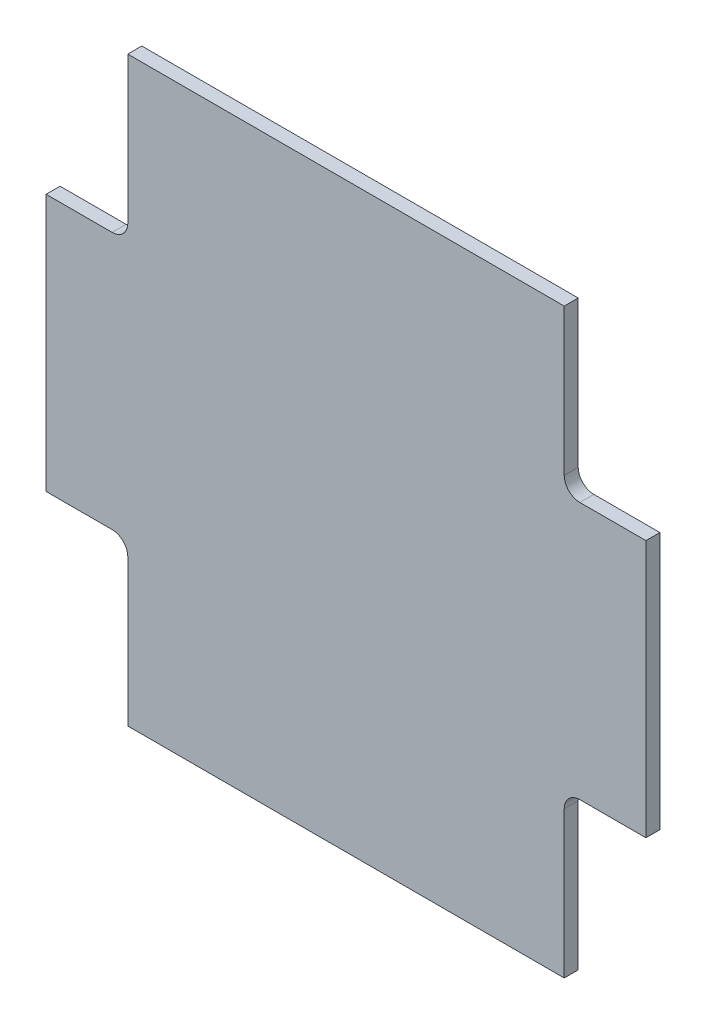
from build123d import *

# Parameters (mm, degrees)
BOSS_EXTRUDE1_DEPTH = 1.5875


with BuildPart() as part:
    # Sketch1 → Boss-Extrude1 (new body)
    with BuildSketch(Plane.XY):
        with BuildLine():
            Line((0, 47.625), (0, 18.415))
            Line((0, 18.415), (7.493, 18.415))
            ThreePointArc((7.493, 18.415), (8.750235857, 17.894235857), (9.271, 16.637))
            Line((9.271, 16.637), (9.271, 0))
            Line((9.271, 0), (58.801, 0))
            Line((58.801, 0), (58.801, 16.637))
            ThreePointArc((58.801, 16.637), (59.321764143, 17.894235857), (60.579, 18.415))
            Line((60.579, 18.415), (68.072, 18.415))
            Line((68.072, 18.415), (68.072, 47.625))
            Line((68.072, 47.625), (60.579, 47.625))
            ThreePointArc((60.579, 47.625), (59.321764143, 48.145764143), (58.801, 49.403))
            Line((58.801, 49.403), (58.801, 66.04))
            Line((58.801, 66.04), (9.271, 66.04))
            Line((9.271, 66.04), (9.271, 49.403))
            ThreePointArc((9.271, 49.403), (8.750235857, 48.145764143), (7.493, 47.625))
            Line((7.493, 47.625), (0, 47.625))
        make_face()
    extrude(amount=BOSS_EXTRUDE1_DEPTH)


solid = part.part
